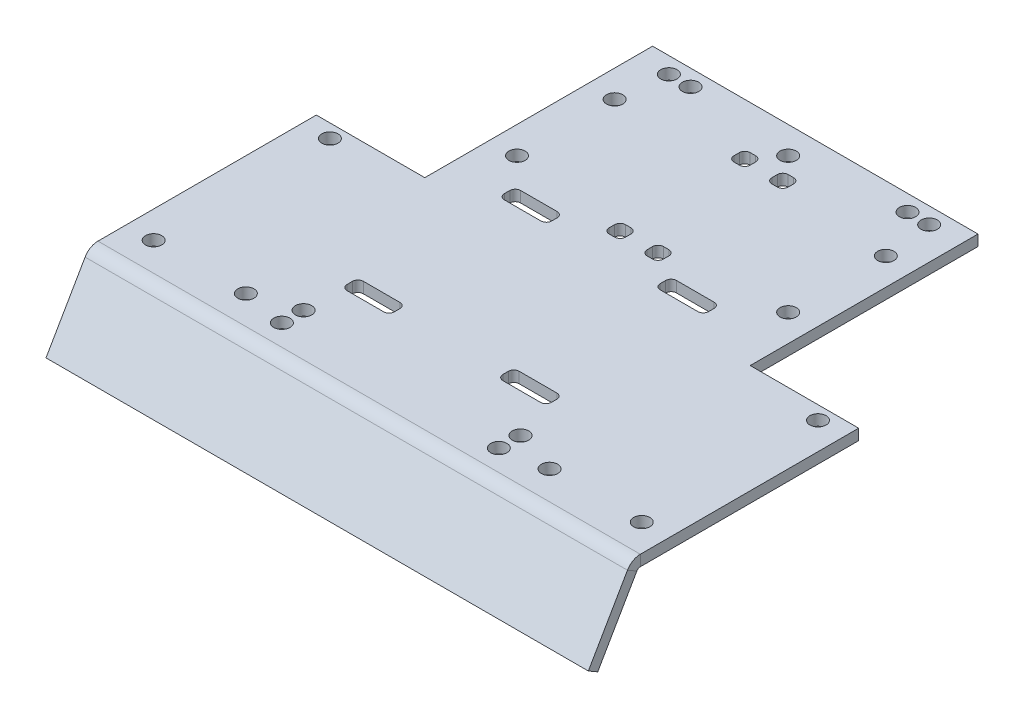
from build123d import *

# Parameters (mm, degrees)
SKETCH1_W            = 100
SKETCH1_H            = 85
BASE_FLANGE1_DEPTH   = 2
EDGE_FLANGE2_DEPTH   = 100
EDGE_FLANGE2_2_DEPTH = 100
SKETCH16_R           = 1.5
SKETCH16_W           = 20
SKETCH16_H           = 42
CUT_EXTRUDE2_DEPTH   = 2
SKETCH18_R           = 1.5
CUT_EXTRUDE3_DEPTH   = 10
SKETCH19_R           = 1.5
CUT_EXTRUDE5_DEPTH   = 10
CUT_EXTRUDE6_DEPTH   = 10
SKETCH21_R           = 1.5
CUT_EXTRUDE7_DEPTH   = 10


# Read off the part's stored shape, not the designer's step: Edge-Flange2
# Sheet-metal steps are written as plain solids
with BuildPart() as part:
    # Sketch1 → Base-Flange1 (new body)
    with BuildSketch(Plane(origin=(0, 0, 0), x_dir=(1, 0, 0), z_dir=(0, 1, 0))):
        with Locations((50, 42.5)):
            Rectangle(SKETCH1_W, SKETCH1_H)
    extrude(amount=-BASE_FLANGE1_DEPTH)

    # Edge-Flange2 outline → Edge-Flange2 (cut)
    with BuildSketch(Plane.YZ):
        with BuildLine():
            Line((-2, 0), (-1.3683, -0.364712165))
            ThreePointArc((-1.3683, -0.364712165), (-0.36663488, -1.366377285), (0, -2.734677285))
            Line((0, -2.734677285), (0, 0))
            Line((0, 0), (-2, 0))
        make_face()
    extrude(amount=EDGE_FLANGE2_DEPTH, mode=Mode.SUBTRACT)

    # Edge-Flange2 2 outline → Edge-Flange2 2 (add)
    with BuildSketch(Plane.YZ):
        with BuildLine():
            Line((-2, -2.734677285), (-2, 0))
            Line((-2, 0), (-13.856406461, 6.845299462))
            Line((-13.856406461, 6.845299462), (-14.856406461, 5.113248654))
            Line((-14.856406461, 5.113248654), (-2.3683, -2.096762973))
            ThreePointArc((-2.3683, -2.096762973), (-2.098685688, -2.366377285), (-2, -2.734677285))
        make_face()
    extrude(amount=EDGE_FLANGE2_2_DEPTH)

    # Sketch16 → Cut-Extrude2 (cut)
    with BuildSketch(Plane(origin=(0, 0, 0), x_dir=(1, 0, 0), z_dir=(0, 1, 0))):
        with Locations(Location((5, 8, 0), (0, 0, 270))):
            Circle(SKETCH16_R)
        with Locations(Location((50, 80, 0), (0, 0, 270))):
            Circle(SKETCH16_R)
        with Locations(Location((5, 40.5, 0), (0, 0, 270))):
            Circle(SKETCH16_R)
        with Locations(Location((95, 8, 0), (0, 0, 90))):
            Circle(SKETCH16_R)
        with Locations(Location((95, 40.5, 0), (0, 0, 90))):
            Circle(SKETCH16_R)
        with Locations(Location((25, 73, 0), (0, 0, 270))):
            Circle(SKETCH16_R)
        with Locations(Location((25, 55, 0), (0, 0, 90))):
            Circle(SKETCH16_R)
        with Locations(Location((75, 55, 0), (0, 0, 270))):
            Circle(SKETCH16_R)
        with Locations(Location((75, 73, 0), (0, 0, 90))):
            Circle(SKETCH16_R)
        with Locations((10, 64)):
            Rectangle(SKETCH16_W, SKETCH16_H)
        with Locations((90, 64)):
            Rectangle(SKETCH16_W, SKETCH16_H)
    extrude(amount=-CUT_EXTRUDE2_DEPTH, mode=Mode.SUBTRACT)

    # Sketch18 → Cut-Extrude3 (cut)
    with BuildSketch(Plane(origin=(0, 0, 0), x_dir=(1, 0, 0), z_dir=(0, 1, 0))):
        with Locations(Location((22, 8, 0), (0, 0, 270))):
            Circle(SKETCH18_R)
        with Locations(Location((78, 8, 0), (0, 0, 90))):
            Circle(SKETCH18_R)
    extrude(amount=-CUT_EXTRUDE3_DEPTH, mode=Mode.SUBTRACT)

    # Sketch19 → Cut-Extrude5 (cut)
    with BuildSketch(Plane(origin=(0, 0, 0), x_dir=(1, 0, 0), z_dir=(0, 1, 0))):
        with Locations(Location((30, 6.646195809, 0), (0, 0, 270))):
            Circle(SKETCH19_R)
        with Locations(Location((30, 10.646195809, 0), (0, 0, 270))):
            Circle(SKETCH19_R)
        with Locations(Location((70, 6.646195809, 0), (0, 0, 90))):
            Circle(SKETCH19_R)
        with Locations(Location((70, 10.646195809, 0), (0, 0, 90))):
            Circle(SKETCH19_R)
    extrude(amount=-CUT_EXTRUDE5_DEPTH, mode=Mode.SUBTRACT)

    # Sketch20 → Cut-Extrude6 (cut)
    with BuildSketch(Plane(origin=(0, 0, 0), x_dir=(1, 0, 0), z_dir=(0, 1, 0))):
        with BuildLine():
            Line((59.619346947, 49.788219715), (66.548820549, 49.788219715))
            ThreePointArc((66.548820549, 49.788219715), (67.25592733, 49.495326496), (67.548820549, 48.788219715))
            Line((67.548820549, 48.788219715), (67.548820549, 47.788219715))
            ThreePointArc((67.548820549, 47.788219715), (67.25592733, 47.081112934), (66.548820549, 46.788219715))
            Line((66.548820549, 46.788219715), (59.619346947, 46.788219715))
            ThreePointArc((59.619346947, 46.788219715), (58.912240166, 47.081112934), (58.619346947, 47.788219715))
            Line((58.619346947, 47.788219715), (58.619346947, 48.788219715))
            ThreePointArc((58.619346947, 48.788219715), (58.912240166, 49.495326496), (59.619346947, 49.788219715))
        make_face()
        with BuildLine():
            Line((30.883992336, 20.788219715), (37.619346947, 20.788219715))
            ThreePointArc((37.619346947, 20.788219715), (38.326453728, 20.495326496), (38.619346947, 19.788219715))
            Line((38.619346947, 19.788219715), (38.619346947, 18.788219715))
            ThreePointArc((38.619346947, 18.788219715), (38.326453728, 18.081112934), (37.619346947, 17.788219715))
            Line((37.619346947, 17.788219715), (30.883992336, 17.788219715))
            ThreePointArc((30.883992336, 17.788219715), (30.176885554, 18.081112934), (29.883992336, 18.788219715))
            Line((29.883992336, 18.788219715), (29.883992336, 19.788219715))
            ThreePointArc((29.883992336, 19.788219715), (30.176885554, 20.495326496), (30.883992336, 20.788219715))
        make_face()
        with BuildLine():
            Line((59.619346947, 20.788219715), (66.548820549, 20.788219715))
            ThreePointArc((66.548820549, 20.788219715), (67.25592733, 20.495326496), (67.548820549, 19.788219715))
            Line((67.548820549, 19.788219715), (67.548820549, 18.788219715))
            ThreePointArc((67.548820549, 18.788219715), (67.25592733, 18.081112934), (66.548820549, 17.788219715))
            Line((66.548820549, 17.788219715), (59.619346947, 17.788219715))
            ThreePointArc((59.619346947, 17.788219715), (58.912240166, 18.081112934), (58.619346947, 18.788219715))
            Line((58.619346947, 18.788219715), (58.619346947, 19.788219715))
            ThreePointArc((58.619346947, 19.788219715), (58.912240166, 20.495326496), (59.619346947, 20.788219715))
        make_face()
        with BuildLine():
            Line((30.883992336, 49.788219715), (37.619346947, 49.788219715))
            ThreePointArc((37.619346947, 49.788219715), (38.326453728, 49.495326496), (38.619346947, 48.788219715))
            Line((38.619346947, 48.788219715), (38.619346947, 47.788219715))
            ThreePointArc((38.619346947, 47.788219715), (38.326453728, 47.081112934), (37.619346947, 46.788219715))
            Line((37.619346947, 46.788219715), (30.883992336, 46.788219715))
            ThreePointArc((30.883992336, 46.788219715), (30.176885554, 47.081112934), (29.883992336, 47.788219715))
            Line((29.883992336, 47.788219715), (29.883992336, 48.788219715))
            ThreePointArc((29.883992336, 48.788219715), (30.176885554, 49.495326496), (30.883992336, 49.788219715))
        make_face()
    extrude(amount=-CUT_EXTRUDE6_DEPTH, mode=Mode.SUBTRACT)

    # Sketch21 → Cut-Extrude7 (cut)
    with BuildSketch(Plane(origin=(0, 0, 0), x_dir=(1, 0, 0), z_dir=(0, 1, 0))):
        with Locations(Location((26, 82, 0), (0, 0, 270))):
            Circle(SKETCH21_R)
        with Locations(Location((30, 82, 0), (0, 0, 270))):
            Circle(SKETCH21_R)
        with Locations(Location((74, 82, 0), (0, 0, 90))):
            Circle(SKETCH21_R)
        with Locations(Location((70, 82, 0), (0, 0, 90))):
            Circle(SKETCH21_R)
        with BuildLine():
            Line((54, 51), (53, 51))
            ThreePointArc((53, 51), (52.292893219, 51.292893219), (52, 52))
            Line((52, 52), (52, 53))
            ThreePointArc((52, 53), (52.292893219, 53.707106781), (53, 54))
            Line((53, 54), (54, 54))
            ThreePointArc((54, 54), (54.707106781, 53.707106781), (55, 53))
            Line((55, 53), (55, 52))
            ThreePointArc((55, 52), (54.707106781, 51.292893219), (54, 51))
        make_face()
        with BuildLine():
            Line((46, 77), (47, 77))
            ThreePointArc((47, 77), (47.707106781, 76.707106781), (48, 76))
            Line((48, 76), (48, 75))
            ThreePointArc((48, 75), (47.707106781, 74.292893219), (47, 74))
            Line((47, 74), (46, 74))
            ThreePointArc((46, 74), (45.292893219, 74.292893219), (45, 75))
            Line((45, 75), (45, 76))
            ThreePointArc((45, 76), (45.292893219, 76.707106781), (46, 77))
        make_face()
        with BuildLine():
            Line((46, 54), (47, 54))
            ThreePointArc((47, 54), (47.707106781, 53.707106781), (48, 53))
            Line((48, 53), (48, 52))
            ThreePointArc((48, 52), (47.707106781, 51.292893219), (47, 51))
            Line((47, 51), (46, 51))
            ThreePointArc((46, 51), (45.292893219, 51.292893219), (45, 52))
            Line((45, 52), (45, 53))
            ThreePointArc((45, 53), (45.292893219, 53.707106781), (46, 54))
        make_face()
        with BuildLine():
            Line((54, 74), (53, 74))
            ThreePointArc((53, 74), (52.292893219, 74.292893219), (52, 75))
            Line((52, 75), (52, 76))
            ThreePointArc((52, 76), (52.292893219, 76.707106781), (53, 77))
            Line((53, 77), (54, 77))
            ThreePointArc((54, 77), (54.707106781, 76.707106781), (55, 76))
            Line((55, 76), (55, 75))
            ThreePointArc((55, 75), (54.707106781, 74.292893219), (54, 74))
        make_face()
    extrude(amount=-CUT_EXTRUDE7_DEPTH, mode=Mode.SUBTRACT)


solid = part.part
